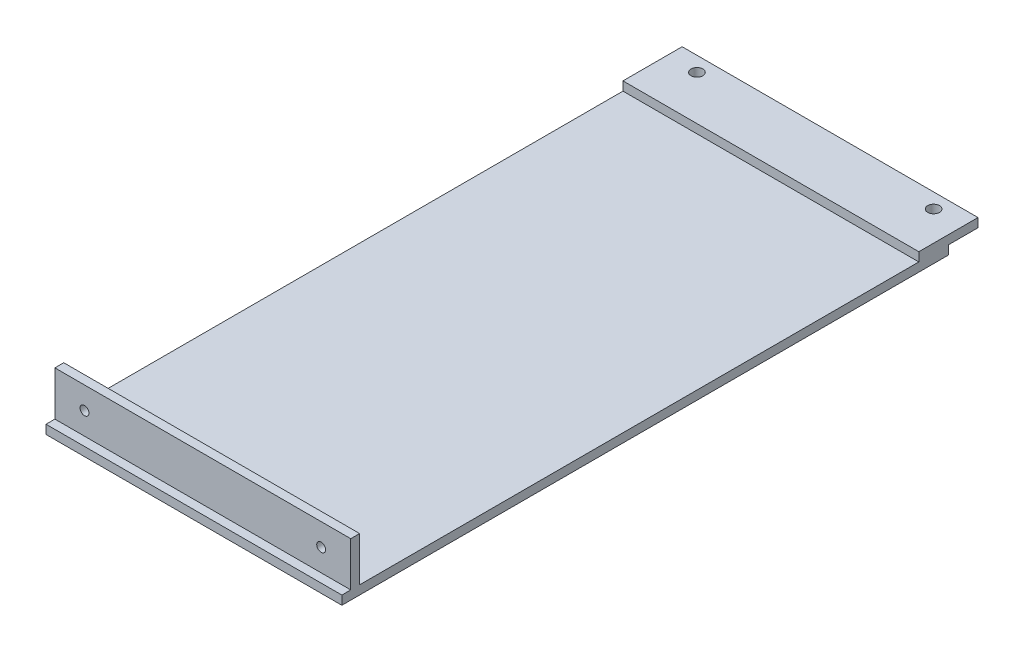
from build123d import *

# Parameters (mm, degrees)
SKETCH1_W           = 100
SKETCH1_H           = 205
BOSS_EXTRUDE1_DEPTH = 3
SKETCH2_W           = 100
SKETCH2_H           = 20
BOSS_EXTRUDE2_DEPTH = 3
CUT_EXTRUDE1_REACH  = 125.257
SKETCH3_R           = 2
LPATTERN1_COUNT     = 2
LPATTERN1_PITCH     = 80
SKETCH4_W           = 100
SKETCH4_H           = 3
BOSS_EXTRUDE3_DEPTH = 15
CUT_EXTRUDE2_REACH  = 220.559
SKETCH5_R           = 1.5
LPATTERN2_COUNT     = 2
LPATTERN2_PITCH     = 80


with BuildPart() as part:
    # Sketch1 → Boss-Extrude1 (new body)
    with BuildSketch(Plane(origin=(0, 0, 0), x_dir=(1, 0, 0), z_dir=(0, 1, 0))):
        Rectangle(SKETCH1_W, SKETCH1_H)
    extrude(amount=BOSS_EXTRUDE1_DEPTH)

    # Sketch2 → Boss-Extrude2 (add)
    with BuildSketch(Plane(origin=(0, 3, 0), x_dir=(1, 0, 0), z_dir=(0, 1, 0))):
        with Locations((0, 102.5)):
            Rectangle(SKETCH2_W, SKETCH2_H)
    extrude(amount=BOSS_EXTRUDE2_DEPTH)

    # Sketch3 → Cut-Extrude1 (cut, up to next)
    with BuildSketch(Plane(origin=(0, 6, 0), x_dir=(1, 0, 0), z_dir=(0, 1, 0)), mode=Mode.PRIVATE) as cut_extrude1_sk1:
        with Locations((-40, 107.5)):
            Circle(SKETCH3_R)
    cut_extrude1_tool1 = extrude(cut_extrude1_sk1.sketch, amount=-CUT_EXTRUDE1_REACH, mode=Mode.PRIVATE) & part.part
    cut_extrude1 = cut_extrude1_tool1.solids().sort_by_distance((-40, 6, -107.5))[0]
    add(cut_extrude1, mode=Mode.SUBTRACT)

    # LPattern1: Cut-Extrude1 ×2
    with Locations(*[(i * LPATTERN1_PITCH, 0, 0) for i in range(1, LPATTERN1_COUNT)]):
        add(cut_extrude1, mode=Mode.SUBTRACT)

    # Sketch4 → Boss-Extrude3 (add)
    with BuildSketch(Plane(origin=(0, 3, 0), x_dir=(1, 0, 0), z_dir=(0, 1, 0))):
        with Locations((0, -98)):
            Rectangle(SKETCH4_W, SKETCH4_H)
    extrude(amount=BOSS_EXTRUDE3_DEPTH)

    # Sketch5 → Cut-Extrude2 (cut, up to next)
    with BuildSketch(Plane.XY.offset(99.5), mode=Mode.PRIVATE) as cut_extrude2_sk1:
        with Locations((-40, 10.5)):
            Circle(SKETCH5_R)
    cut_extrude2_tool1 = extrude(cut_extrude2_sk1.sketch, amount=-CUT_EXTRUDE2_REACH, mode=Mode.PRIVATE) & part.part
    cut_extrude2 = cut_extrude2_tool1.solids().sort_by_distance((-40, 10.5, 99.5))[0]
    add(cut_extrude2, mode=Mode.SUBTRACT)

    # LPattern2: Cut-Extrude2 ×2
    with Locations(*[(i * LPATTERN2_PITCH, 0, 0) for i in range(1, LPATTERN2_COUNT)]):
        add(cut_extrude2, mode=Mode.SUBTRACT)


solid = part.part
